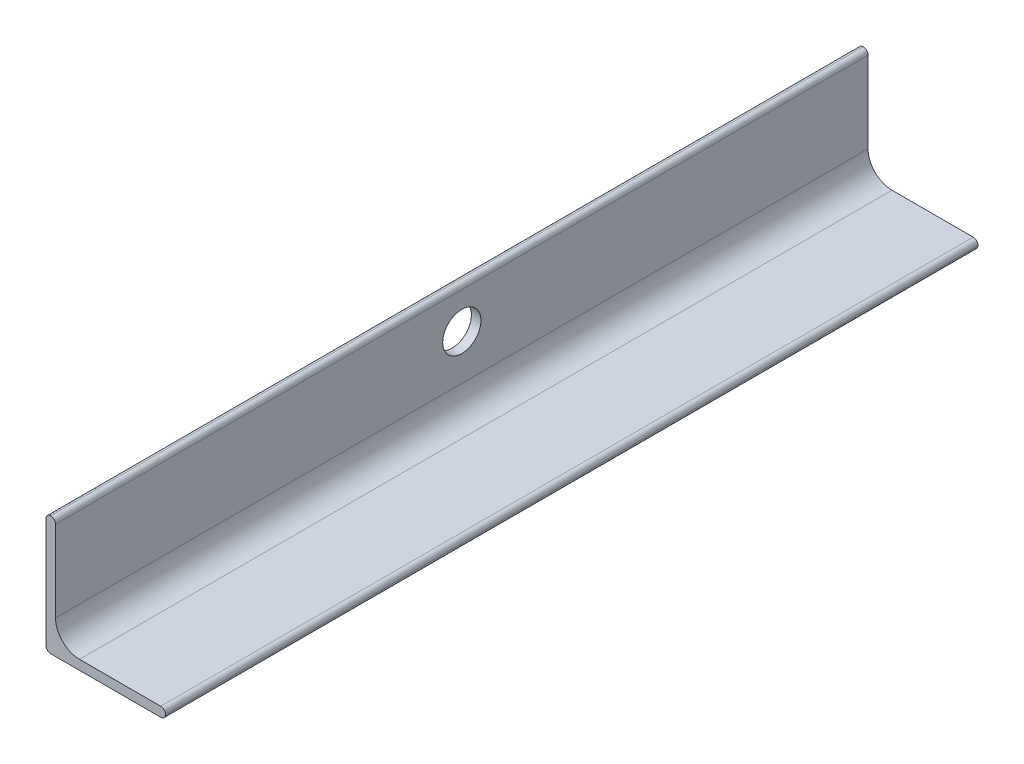
from build123d import *

# Parameters (mm, degrees)
EXTRUDE_1_DEPTH     = 170
FILLET_1_R          = 1
SKETCH_2_R          = 4
CUT_EXTRUDE_1_DEPTH = 174.360895245


with BuildPart() as part:
    # 草图1 → 凸台-拉伸1 (new body)
    with BuildSketch(Plane.XY):
        with BuildLine():
            Line((0, 0), (25, 0))
            Line((25, 0), (25, 2))
            Line((25, 2), (7, 2))
            ThreePointArc((7, 2), (3.464466094, 3.464466094), (2, 7))
            Line((2, 7), (2, 25))
            Line((2, 25), (0, 25))
            Line((0, 25), (0, 0))
        make_face()
    extrude(amount=EXTRUDE_1_DEPTH)

    # 圆角1
    fillet_1_edges = [part.edges().sort_by_distance(p)[0] for p in [
        (0, 25, 85),
        (25, 2, 85),
        (25, 0, 85),
        (0, 0, 85),
        (2, 25, 85),
    ]]
    fillet(fillet_1_edges, radius=FILLET_1_R - 0.0001)  # a hair under: the kernel refuses the full size

    # 草图2 → 切除-拉伸1 (cut, through all)
    with BuildSketch(Plane(origin=(2, 0, 0), x_dir=(0, 0, -1), z_dir=(1, 0, 0))):
        with Locations(Location((-85, 16.401885755, 0), (0, 0, 90))):
            Circle(SKETCH_2_R)
    extrude(amount=-CUT_EXTRUDE_1_DEPTH, mode=Mode.SUBTRACT)


solid = part.part
